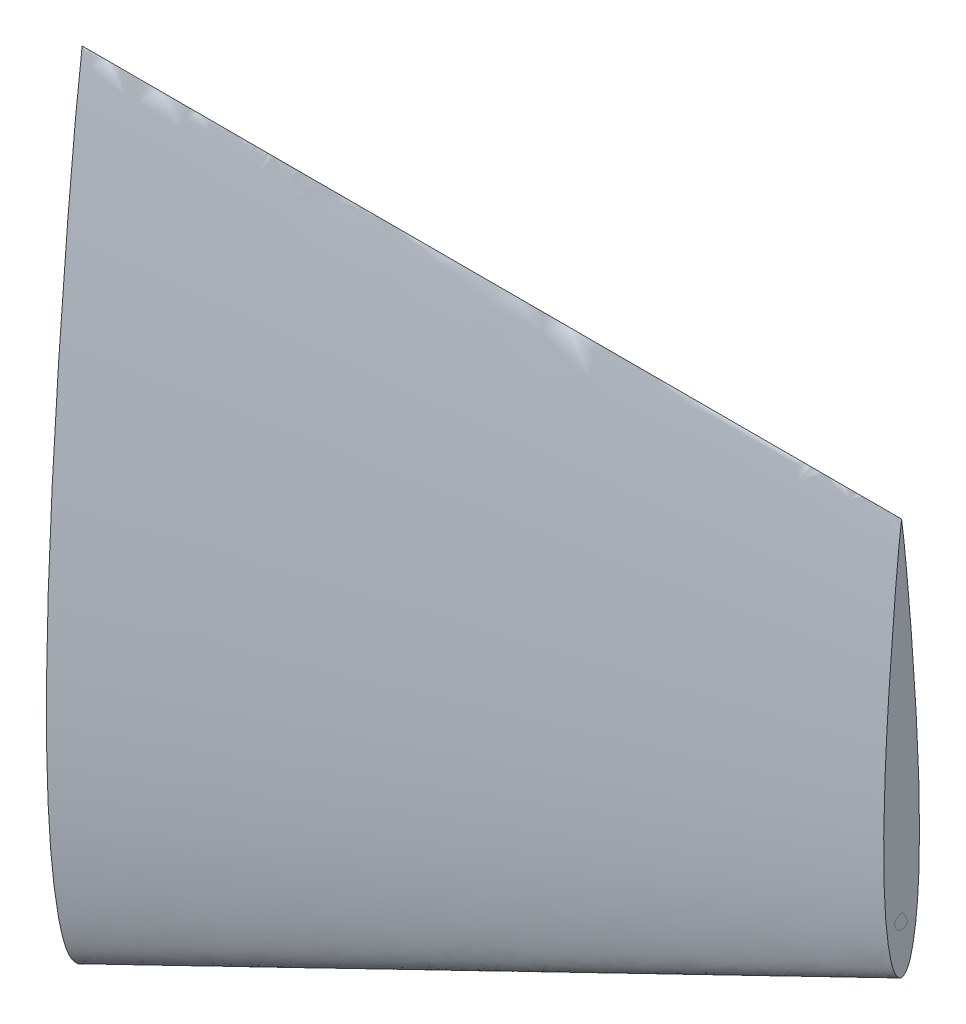
from build123d import *

# Parameters (mm, degrees)
SKETCH_7_R = 1


with BuildPart() as part:
    # 边界1: read off the stored shape, not the designer's step
    # 边界1: loft between two sections, ruled curve by curve
    other_1_from = [
        Edge.make_bspline([(0, 114.4, 0), (0, 114.4, 0.007283832), (0, 114.21163069, 0.021848837), (0, 114.080118647, 0.043628247), (0, 113.796890955, 0.079514286), (0, 113.426193351, 0.128529824), (0, 112.936855294, 0.18976694), (0, 112.346167, 0.26242899), (0, 110.280049708, 0.51019447), (0, 105.348652112, 1.036109846), (0, 98.804019609, 1.646960293), (0, 89.588748002, 2.438566234), (0, 78.598240942, 3.29258827), (0, 64.503672569, 4.213184102), (0, 49.909977833, 4.914175355), (0, 38.983481039, 5.16800985), (0, 31.937279333, 5.159629577), (0, 28.640454039, 5.115749057), (0, 25.465916509, 5.038861572), (0, 21.515311132, 4.887732663), (0, 16.244348489, 4.576144308), (0, 11.335837752, 4.063512647), (0, 7.728885363, 3.480029887), (0, 5.964698517, 3.137385513), (0, 4.417081382, 2.772564157), (0, 3.093283382, 2.373338217), (0, 1.914166214, 1.899269319), (0, 1.059544765, 1.397620101), (0, 0.512892323, 0.915140017), (0, 0.262612741, 0.629628981), (0, 0.104439841, 0.378528288), (0, 0.018787658, 0.186587242), (0, -0.00614085, 0), (0, 0.018787658, -0.186587242), (0, 0.104439841, -0.378528288), (0, 0.262612741, -0.629628981), (0, 0.512892323, -0.915140017), (0, 1.059544765, -1.397620101), (0, 1.914166214, -1.899269319), (0, 3.093283382, -2.373338217), (0, 4.417081382, -2.772564157), (0, 5.964698517, -3.137385513), (0, 7.728885363, -3.480029887), (0, 11.335837752, -4.063512647), (0, 16.244348489, -4.576144308), (0, 21.515311132, -4.887732663), (0, 25.465916509, -5.038861572), (0, 28.640454039, -5.115749057), (0, 31.937279333, -5.159629577), (0, 38.983481039, -5.16800985), (0, 49.909977833, -4.914175355), (0, 64.503672569, -4.213184102), (0, 78.598240942, -3.29258827), (0, 89.588748002, -2.438566234), (0, 98.804019609, -1.646960293), (0, 105.348652112, -1.036109846), (0, 110.280049708, -0.51019447), (0, 112.346167, -0.26242899), (0, 112.936855294, -0.18976694), (0, 113.426193351, -0.128529824), (0, 113.796890955, -0.079514286), (0, 114.080118647, -0.043628247), (0, 114.21163069, -0.021848837), (0, 114.4, -0.007283832), (0, 114.4, 0)], [0, 0, 0, 0, 0.000711186, 0.001422112, 0.002133252, 0.004251581, 0.006369198, 0.008487526, 0.011973078, 0.033316573, 0.072750533, 0.097133325, 0.153150736, 0.215572756, 0.28012949, 0.342436877, 0.357160037, 0.371419983, 0.385154319, 0.398301185, 0.422640862, 0.45355583, 0.462206438, 0.469975829, 0.476836911, 0.482800105, 0.487877314, 0.493276037, 0.495568649, 0.497302284, 0.498179926, 0.499405099, 0.5, 0.500594901, 0.501820074, 0.502697716, 0.504431351, 0.506723963, 0.512122686, 0.517199895, 0.523163089, 0.530024171, 0.537793562, 0.54644417, 0.577359138, 0.601698815, 0.614845681, 0.628580017, 0.642839963, 0.657563123, 0.71987051, 0.784427244, 0.846849264, 0.902866675, 0.927249467, 0.966683427, 0.988026922, 0.991512474, 0.993630802, 0.995748419, 0.997866748, 0.998577888, 0.999288814, 1, 1, 1, 1], 3),
    ]
    other_1_to = [
        Edge.make_bspline([(118, 114.4, 0), (118, 114.4, 0.003641916), (118, 114.305815345, 0.010924418), (118, 114.240059323, 0.021814123), (118, 114.098445477, 0.039757143), (118, 113.913096675, 0.064264912), (118, 113.668427647, 0.09488347), (118, 113.3730835, 0.131214495), (118, 112.340024854, 0.255097235), (118, 109.874326056, 0.518054923), (118, 106.602009805, 0.823480147), (118, 101.994374001, 1.219283117), (118, 96.499120471, 1.646294135), (118, 89.451836285, 2.106592051), (118, 82.154988917, 2.457087677), (118, 76.69174052, 2.584004925), (118, 73.168639667, 2.579814789), (118, 71.520227019, 2.557874528), (118, 69.932958254, 2.519430786), (118, 67.957655566, 2.443866331), (118, 65.322174244, 2.288072154), (118, 62.867918876, 2.031756324), (118, 61.064442682, 1.740014943), (118, 60.182349259, 1.568692756), (118, 59.408540691, 1.386282078), (118, 58.746641691, 1.186669108), (118, 58.157083107, 0.949634659), (118, 57.729772382, 0.698810051), (118, 57.456446161, 0.457570009), (118, 57.33130637, 0.314814491), (118, 57.252219921, 0.189264144), (118, 57.209393829, 0.093293621), (118, 57.196929575, 0), (118, 57.209393829, -0.093293621), (118, 57.252219921, -0.189264144), (118, 57.33130637, -0.314814491), (118, 57.456446161, -0.457570009), (118, 57.729772382, -0.698810051), (118, 58.157083107, -0.949634659), (118, 58.746641691, -1.186669108), (118, 59.408540691, -1.386282078), (118, 60.182349259, -1.568692756), (118, 61.064442682, -1.740014943), (118, 62.867918876, -2.031756324), (118, 65.322174244, -2.288072154), (118, 67.957655566, -2.443866331), (118, 69.932958254, -2.519430786), (118, 71.520227019, -2.557874528), (118, 73.168639667, -2.579814789), (118, 76.69174052, -2.584004925), (118, 82.154988917, -2.457087677), (118, 89.451836285, -2.106592051), (118, 96.499120471, -1.646294135), (118, 101.994374001, -1.219283117), (118, 106.602009805, -0.823480147), (118, 109.874326056, -0.518054923), (118, 112.340024854, -0.255097235), (118, 113.3730835, -0.131214495), (118, 113.668427647, -0.09488347), (118, 113.913096675, -0.064264912), (118, 114.098445477, -0.039757143), (118, 114.240059323, -0.021814123), (118, 114.305815345, -0.010924418), (118, 114.4, -0.003641916), (118, 114.4, 0)], [0, 0, 0, 0, 0.000711186, 0.001422112, 0.002133252, 0.004251581, 0.006369198, 0.008487526, 0.011973078, 0.033316573, 0.072750533, 0.097133325, 0.153150736, 0.215572756, 0.28012949, 0.342436877, 0.357160037, 0.371419983, 0.385154319, 0.398301185, 0.422640862, 0.45355583, 0.462206438, 0.469975829, 0.476836911, 0.482800105, 0.487877314, 0.493276037, 0.495568649, 0.497302284, 0.498179926, 0.499405099, 0.5, 0.500594901, 0.501820074, 0.502697716, 0.504431351, 0.506723963, 0.512122686, 0.517199895, 0.523163089, 0.530024171, 0.537793562, 0.54644417, 0.577359138, 0.601698815, 0.614845681, 0.628580017, 0.642839963, 0.657563123, 0.71987051, 0.784427244, 0.846849264, 0.902866675, 0.927249467, 0.966683427, 0.988026922, 0.991512474, 0.993630802, 0.995748419, 0.997866748, 0.998577888, 0.999288814, 1, 1, 1, 1], 3),
    ]
    other_1 = Solid(Shell([*[Face.make_surface_from_curves(other_1_from[k], other_1_to[k]) for k in range(1)], Face(Wire(other_1_from)), Face(Wire(other_1_to))]))
    add(other_1)


with BuildPart() as body_2:
    # 扫描1: sweep along a path in 草图6
    with BuildLine(Plane.XY) as sweep_1_path:
        Line((0, -20), (118, 37.2))
    # 草图7 → 扫描1 (sweep)
    with BuildSketch(Plane.ZY):
        with Locations((0, 7)):
            Circle(SKETCH_7_R)
    sweep(path=sweep_1_path.line)


solid = Compound([part.part, body_2.part])
